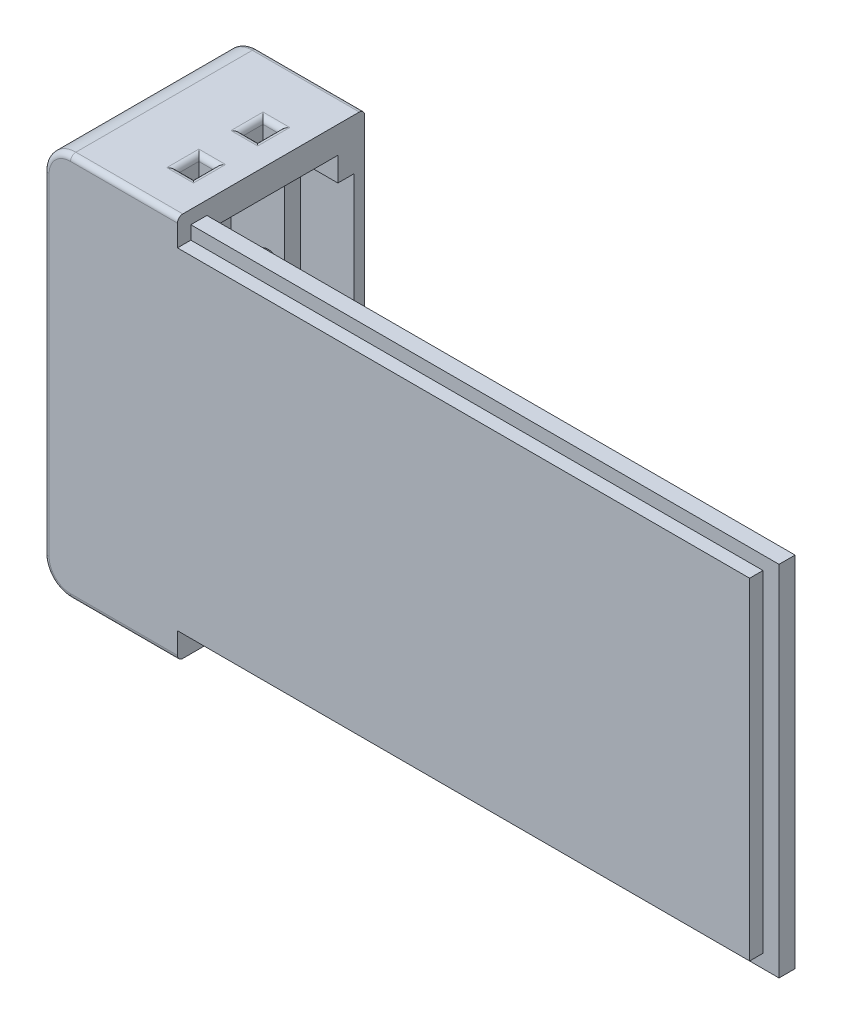
from build123d import *

# Parameters (mm, degrees)
ESQUISSE1_W                 = 135
ESQUISSE1_H                 = 67
BOSS_EXTRU_1_DEPTH          = 3
ESQUISSE3_W                 = 132
ESQUISSE3_H                 = 62
BOSS_EXTRU_2_DEPTH          = 2.5
ESQUISSE4_W                 = 25
ESQUISSE4_H                 = 5
BOSS_EXTRU_3_DEPTH          = 35
BOSS_EXTRU_4_START          = -5
ESQUISSE5_W                 = 25
ESQUISSE5_H                 = 72
BOSS_EXTRU_4_DEPTH          = 5
ENL_V_MAT_EXTRU_2_REACH     = 135.469
ESQUISSE10_R                = 2.47
ESQUISSE10_R_2              = 2.5
ENL_V_START                 = -3
ESQUISSE11_W                = 10
ESQUISSE11_H                = 53
ENL_V_MAT_EXTRU_3_DEPTH     = 3
ESQUISSE13_R                = 2.47
BOSS_EXTRU_5_DEPTH          = 1
BOSS_EXTRU_6_REACH          = 134.133
ESQUISSE14_W                = 5
ESQUISSE14_H                = 62
ESQUISSE15_R                = 2.47
ENL_V_MAT_EXTRU_5_DEPTH     = 0.5
CONG_1_R                    = 0.25
ESQUISSE21_W                = 3
ESQUISSE21_H                = 5
BOSS_EXTRU_8_DEPTH          = 72
CONG_2_R                    = 5
CONG_3_R                    = 1
ENL_V_MAT_EXTRU_8_DEPTH     = 0.2
ESQUISSE25_R                = 8.5
ESQUISSE25_R_2              = 6.5
ENL_V_MAT_EXTRU_9_DEPTH     = 0.2
ENL_V_MAT_EXTRU_10_REACH    = 155.572
ESQUISSE26_R                = 2.5
CONG_4_R                    = 1
LOGEMENT_START              = -8
LOGEMENT_D_ERGOT1_OUTLINE_W = 5
LOGEMENT_D_ERGOT1_OUTLINE_H = 4
LOGEMENT_D_ERGOT1_DEPTH     = 3
LOGEMENT_D_ERGOT2_OUTLINE_W = 5
LOGEMENT_D_ERGOT2_OUTLINE_H = 4
LOGEMENT_D_ERGOT2_DEPTH     = 3
R_P_TITION_LIN_AIRE1_COUNT  = 2
R_P_TITION_LIN_AIRE1_PITCH  = 12
CONG_6_R                    = 1


# Read off the part's stored shape, not the designer's step: Logement d'ergot1, Logement d'ergot2
with BuildPart() as part:
    # Esquisse1 → Boss.-Extru.1 (new body)
    with BuildSketch(Plane.XY):
        with Locations((42.5, 31)):
            Rectangle(ESQUISSE1_W, ESQUISSE1_H)
    extrude(amount=BOSS_EXTRU_1_DEPTH)

    # Esquisse3 → Boss.-Extru.2 (add)
    with BuildSketch(Plane.XY.offset(3)):
        with Locations((41, 31)):
            Rectangle(ESQUISSE3_W, ESQUISSE3_H)
    extrude(amount=BOSS_EXTRU_2_DEPTH)

    # Esquisse4 → Boss.-Extru.3 (add)
    with BuildSketch(Plane.XY.offset(5.5)):
        with Locations((-12.5, 64.5)):
            Rectangle(ESQUISSE4_W, ESQUISSE4_H)
        with Locations((-12.5, -2.5)):
            Rectangle(ESQUISSE4_W, ESQUISSE4_H)
    extrude(amount=-BOSS_EXTRU_3_DEPTH)

    # Esquisse5 → Boss.-Extru.4 (add)
    with BuildSketch(Plane(origin=(0, 0, -29.5), x_dir=(-1, 0, 0), z_dir=(0, 0, -1)).offset(BOSS_EXTRU_4_START)):
        with Locations((12.5, 31)):
            Rectangle(ESQUISSE5_W, ESQUISSE5_H)
    extrude(amount=BOSS_EXTRU_4_DEPTH)

    # Esquisse10 → Enlèv. mat.-Extru.2 (cut, up to next)
    with BuildSketch(Plane(origin=(0, 0, -29.5), x_dir=(-1, 0, 0), z_dir=(0, 0, -1)), mode=Mode.PRIVATE) as enl_v_mat_extru_2_sk1:
        with Locations((12.984944126, 18.697458299)):
            Circle(ESQUISSE10_R)
    enl_v_mat_extru_2_tool1 = extrude(enl_v_mat_extru_2_sk1.sketch, amount=-ENL_V_MAT_EXTRU_2_REACH, mode=Mode.PRIVATE) & part.part
    # Esquisse10 → Enlèv. mat.-Extru.2 (cut, up to next)
    with BuildSketch(Plane(origin=(0, 0, -29.5), x_dir=(-1, 0, 0), z_dir=(0, 0, -1)), mode=Mode.PRIVATE) as enl_v_mat_extru_2_sk2:
        with Locations((12.984815451, 25.047239168)):
            Circle(ESQUISSE10_R)
    enl_v_mat_extru_2_tool2 = extrude(enl_v_mat_extru_2_sk2.sketch, amount=-ENL_V_MAT_EXTRU_2_REACH, mode=Mode.PRIVATE) & part.part
    # Esquisse10 → Enlèv. mat.-Extru.2 (cut, up to next)
    with BuildSketch(Plane(origin=(0, 0, -29.5), x_dir=(-1, 0, 0), z_dir=(0, 0, -1)), mode=Mode.PRIVATE) as enl_v_mat_extru_2_sk3:
        with Locations((12.985, 37.7475)):
            Circle(ESQUISSE10_R_2)
    enl_v_mat_extru_2_tool3 = extrude(enl_v_mat_extru_2_sk3.sketch, amount=-ENL_V_MAT_EXTRU_2_REACH, mode=Mode.PRIVATE) & part.part
    add(enl_v_mat_extru_2_tool1.solids().sort_by_distance((-12.984944, 18.697458, -29.5))[0], mode=Mode.SUBTRACT)
    add(enl_v_mat_extru_2_tool2.solids().sort_by_distance((-12.984815, 25.047239, -29.5))[0], mode=Mode.SUBTRACT)
    add(enl_v_mat_extru_2_tool3.solids().sort_by_distance((-12.985, 37.7475, -29.5))[0], mode=Mode.SUBTRACT)

    # Esquisse11 → Enlèv. mat.-Extru.3 (cut)
    with BuildSketch(Plane.XY.offset(-24.5).offset(ENL_V_START)):
        with Locations((-5, 31)):
            Rectangle(ESQUISSE11_W, ESQUISSE11_H)
    extrude(amount=ENL_V_MAT_EXTRU_3_DEPTH, mode=Mode.SUBTRACT)

    # Esquisse13 → Boss.-Extru.5 (add)
    with BuildSketch(Plane(origin=(0, 0, -29.5), x_dir=(-1, 0, 0), z_dir=(0, 0, -1))):
        with Locations((12.984815451, 25.047239168)):
            Circle(ESQUISSE13_R)
        with Locations((12.984944126, 18.697458299)):
            Circle(ESQUISSE13_R)
    extrude(amount=-BOSS_EXTRU_5_DEPTH)

    # Esquisse14 → Boss.-Extru.6 (add, up to next)
    with BuildSketch(Plane(origin=(0, 0, 0), x_dir=(-1, 0, 0), z_dir=(0, 0, -1)), mode=Mode.PRIVATE) as boss_extru_6_sk1:
        with Locations((22.5, 31)):
            Rectangle(ESQUISSE14_W, ESQUISSE14_H)
    boss_extru_6_tool1 = extrude(boss_extru_6_sk1.sketch, amount=BOSS_EXTRU_6_REACH, mode=Mode.PRIVATE) - part.part
    add(boss_extru_6_tool1.solids().sort_by_distance((-22.5, 31, 0))[0])

    # Esquisse15 → Enlèv. mat.-Extru.5 (cut)
    with BuildSketch(Plane(origin=(0, 0, -29.5), x_dir=(-1, 0, 0), z_dir=(0, 0, -1))):
        with Locations((12.984815451, 25.047239168)):
            Circle(ESQUISSE15_R)
        with Locations((12.984944126, 18.697458299)):
            Circle(ESQUISSE15_R)
    extrude(amount=-ENL_V_MAT_EXTRU_5_DEPTH, mode=Mode.SUBTRACT)

    # Congé1
    cong_1_edges = [part.edges().sort_by_distance(p)[0] for p in [
        (-10.485, 37.7475, -29.5),
        (-10.514815451, 25.047239168, -29),
        (-10.514815451, 25.047239168, -29.5),
        (-10.514944126, 18.697458299, -29),
        (-10.514944126, 18.697458299, -29.5),
    ]]
    fillet(cong_1_edges, radius=CONG_1_R - 0.0001)  # a hair under: the kernel refuses the full size

    # Esquisse21 → Boss.-Extru.8 (add)
    with BuildSketch(Plane(origin=(0, 67, 0), x_dir=(1, 0, 0), z_dir=(0, 1, 0))):
        with Locations((-18.5, 11.8)):
            Rectangle(ESQUISSE21_W, ESQUISSE21_H)
    extrude(amount=-BOSS_EXTRU_8_DEPTH)

    # Congé2
    cong_2_edges = [part.edges().sort_by_distance(p)[0] for p in [
        (-25, 67, -12),
        (-25, -5, -12),
    ]]
    fillet(cong_2_edges, radius=CONG_2_R)

    # Congé3
    cong_3_edges = [part.edges().sort_by_distance(p)[0] for p in [
        (-25, 31, 5.5),
        (-10, -5, 5.5),
        (-23.535533906, -3.535533906, 5.5),
        (-23.535533906, 65.535533906, 5.5),
        (-25, 31, -29.5),
        (-10, -5, -29.5),
        (-23.535533906, -3.535533906, -29.5),
        (-23.535533906, 65.535533906, -29.5),
        (-10, 67, 5.5),
        (-10, 67, -29.5),
    ]]
    fillet(cong_3_edges, radius=CONG_3_R)

    # Esquisse24 → Enlèv. mat.-Extru.8 (cut)
    with BuildSketch(Plane.ZY.offset(25)):
        with BuildLine():
            add(Edge.make_bspline(
                [(-7.797334559, 53.756323529), (-7.728315532, 53.756175872), (-7.601468651, 53.7559045), (-7.428145196, 53.736234261), (-7.286694326, 53.712237322), (-7.178098613, 53.672157419), (-7.095998501, 53.627072015), (-7.041252917, 53.572172359), (-7.003626634, 53.511552881), (-7.001217493, 53.466560876), (-7, 53.443823529)],
                knots=[0, 0, 0, 0, 1.771400766, 3.255575653, 4.478900681, 5.443894768, 6.220091676, 6.860135845, 7.423953526, 8, 8, 8, 8], degree=3))
            Line((-7, 53.443823529), (-7, 47.883161765))
            add(Edge.make_bspline(
                [(-7, 47.883161765), (-7.001593321, 47.862838122), (-7.00492213, 47.820377412), (-7.040583617, 47.761793101), (-7.096964513, 47.709342565), (-7.177915255, 47.663809955), (-7.286775543, 47.624151759), (-7.427976902, 47.599172825), (-7.601685227, 47.584051948), (-7.728358713, 47.581333294), (-7.797334559, 47.579852941)],
                knots=[0, 0, 0, 0, 0.522436398, 1.091488403, 1.723587402, 2.506990303, 3.480943124, 4.715625158, 6.211602601, 8, 8, 8, 8], degree=3))
            add(Edge.make_bspline(
                [(-7.797334559, 47.579852941), (-7.867786717, 47.580773828), (-7.996605782, 47.582457635), (-8.173207561, 47.593155762), (-8.315961488, 47.621997479), (-8.429833376, 47.655346871), (-8.514079758, 47.703445754), (-8.575133835, 47.75575082), (-8.610577391, 47.819908595), (-8.615293216, 47.865167141), (-8.617647059, 47.887757353)],
                knots=[0, 0, 0, 0, 1.773003767, 3.241869288, 4.439695969, 5.432846344, 6.20953313, 6.864051949, 7.43300637, 8, 8, 8, 8], degree=3))
            Line((-8.617647059, 47.887757353), (-8.617647059, 49.785735294))
            Line((-8.617647059, 49.785735294), (-14.941176471, 49.785735294))
            Line((-14.941176471, 49.785735294), (-14.058823529, 48.163492647))
            add(Edge.make_bspline(
                [(-14.058823529, 48.163492647), (-14.034251215, 48.109627764), (-13.991196833, 48.015248408), (-13.953583795, 47.88381649), (-13.944362206, 47.771915186), (-13.999202183, 47.682230452), (-14.102194358, 47.626246046), (-14.250196656, 47.59658994), (-14.453807512, 47.58412145), (-14.608747364, 47.581408757), (-14.697610294, 47.579852941)],
                knots=[0, 0, 0, 0, 1.162555523, 2.0369717, 2.700617888, 3.295579197, 3.986269157, 4.9483859, 6.24980231, 8, 8, 8, 8], degree=3))
            add(Edge.make_bspline(
                [(-14.697610294, 47.579852941), (-14.75504882, 47.580598029), (-14.859224961, 47.581949395), (-15.001289632, 47.584071474), (-15.118606847, 47.59741699), (-15.215838356, 47.621630964), (-15.296887854, 47.6583389), (-15.363101065, 47.710736647), (-15.421984833, 47.779239598), (-15.458688166, 47.83147518), (-15.478860294, 47.860183824)],
                knots=[0, 0, 0, 0, 1.562865005, 2.83456521, 3.863171953, 4.767815064, 5.550773938, 6.263486697, 7.045613374, 8, 8, 8, 8], degree=3))
            Line((-15.478860294, 47.860183824), (-16.896599265, 50.024705882))
            add(Edge.make_bspline(
                [(-16.896599265, 50.024705882), (-16.907187932, 50.038879245), (-16.929735099, 50.069059546), (-16.952461714, 50.126608011), (-16.966297115, 50.19762465), (-16.985392787, 50.285056956), (-16.99114045, 50.3969504), (-16.999626832, 50.53850419), (-17.000132424, 50.717129232), (-17.000047258, 50.849623378), (-17, 50.923143382)],
                knots=[0, 0, 0, 0, 0.4618991, 0.983553085, 1.601629665, 2.357151981, 3.323543642, 4.528864361, 6.073892979, 8, 8, 8, 8], degree=3))
            add(Edge.make_bspline(
                [(-17, 50.923143382), (-16.999830765, 51.013527737), (-16.999529463, 51.174445291), (-16.991524933, 51.389951645), (-16.975349625, 51.554110689), (-16.957607732, 51.675990464), (-16.928042836, 51.761637166), (-16.881705598, 51.815064511), (-16.824874861, 51.842020676), (-16.784272558, 51.843695064), (-16.763327206, 51.844558824)],
                knots=[0, 0, 0, 0, 2.095580226, 3.73090726, 4.997875071, 5.917553662, 6.586981439, 7.064814255, 7.517569373, 8, 8, 8, 8], degree=3))
            Line((-16.763327206, 51.844558824), (-8.617647059, 51.844558824))
            Line((-8.617647059, 51.844558824), (-8.617647059, 53.450716912))
            add(Edge.make_bspline(
                [(-8.617647059, 53.450716912), (-8.615293369, 53.473308016), (-8.610577851, 53.51856835), (-8.57513187, 53.582712006), (-8.514089062, 53.63508267), (-8.429786556, 53.682854853), (-8.316471675, 53.717842497), (-8.17244512, 53.738051789), (-7.996880324, 53.75539496), (-7.867860691, 53.755995342), (-7.797334559, 53.756323529)],
                knots=[0, 0, 0, 0, 0.567362121, 1.136686307, 1.7916305, 2.568822057, 3.562617884, 4.754380918, 6.225843952, 8, 8, 8, 8], degree=3))
        make_face()
    extrude(amount=-ENL_V_MAT_EXTRU_8_DEPTH, mode=Mode.SUBTRACT)

    # Esquisse25 → Enlèv. mat.-Extru.9 (cut)
    with BuildSketch(Plane.ZY.offset(25)):
        with Locations(Location((-11.76, 50.692538359, 0), (0, 0, 270))):
            Circle(ESQUISSE25_R)
        with Locations(Location((-11.76, 50.692538359, 0), (0, 0, 270))):
            Circle(ESQUISSE25_R_2, mode=Mode.SUBTRACT)
    extrude(amount=-ENL_V_MAT_EXTRU_9_DEPTH, mode=Mode.SUBTRACT)

    # Esquisse26 → Enlèv. mat.-Extru.10 (cut, up to next)
    with BuildSketch(Plane.ZY.offset(25), mode=Mode.PRIVATE) as enl_v_mat_extru_10_sk1:
        with Locations(Location((-4.5, 17, 0), (0, 0, 270))):
            Circle(ESQUISSE26_R)
    enl_v_mat_extru_10_tool1 = extrude(enl_v_mat_extru_10_sk1.sketch, amount=-ENL_V_MAT_EXTRU_10_REACH, mode=Mode.PRIVATE) & part.part
    add(enl_v_mat_extru_10_tool1.solids().sort_by_distance((-25, 17, -4.5))[0], mode=Mode.SUBTRACT)

    # Congé4
    cong_4_edges = [part.edges().sort_by_distance(p)[0] for p in [
        (-25, 19.5, -4.5),
        (-20, 19.5, -4.5),
    ]]
    fillet(cong_4_edges, radius=CONG_4_R)

    # Logement d'ergot1 outline → Logement d'ergot1 (cut)
    with BuildSketch(Plane.YZ.offset(LOGEMENT_START)):
        with Locations((-2.5, -4.5)):
            Rectangle(LOGEMENT_D_ERGOT1_OUTLINE_W, LOGEMENT_D_ERGOT1_OUTLINE_H)
    logement_d_ergot1 = extrude(amount=LOGEMENT_D_ERGOT1_DEPTH, mode=Mode.SUBTRACT)

    # Logement d'ergot2 outline → Logement d'ergot2 (cut)
    with BuildSketch(Plane.YZ.offset(LOGEMENT_START)):
        with Locations((64.5, -4.5)):
            Rectangle(LOGEMENT_D_ERGOT2_OUTLINE_W, LOGEMENT_D_ERGOT2_OUTLINE_H)
    logement_d_ergot2 = extrude(amount=LOGEMENT_D_ERGOT2_DEPTH, mode=Mode.SUBTRACT)

    # Répétition linéaire1: Logement d'ergot1, Logement d'ergot2 ×2
    with Locations(*[(0, 0, -i * R_P_TITION_LIN_AIRE1_PITCH) for i in range(1, R_P_TITION_LIN_AIRE1_COUNT)]):
        add(logement_d_ergot1, mode=Mode.SUBTRACT)
        add(logement_d_ergot2, mode=Mode.SUBTRACT)

    # Congé6
    cong_6_edges = [part.edges().sort_by_distance(p)[0] for p in [
        (-5, -5, -4.5),
        (-6.5, -5, -2.5),
        (-6.5, -5, -6.5),
        (-8, -5, -4.5),
        (-5, 67, -4.5),
        (-6.5, 67, -6.5),
        (-6.5, 67, -2.5),
        (-8, 67, -4.5),
        (-5, -5, -16.5),
        (-6.5, -5, -14.5),
        (-6.5, -5, -18.5),
        (-8, -5, -16.5),
        (-5, 67, -16.5),
        (-6.5, 67, -18.5),
        (-6.5, 67, -14.5),
        (-8, 67, -16.5),
    ]]
    fillet(cong_6_edges, radius=CONG_6_R)


solid = part.part
